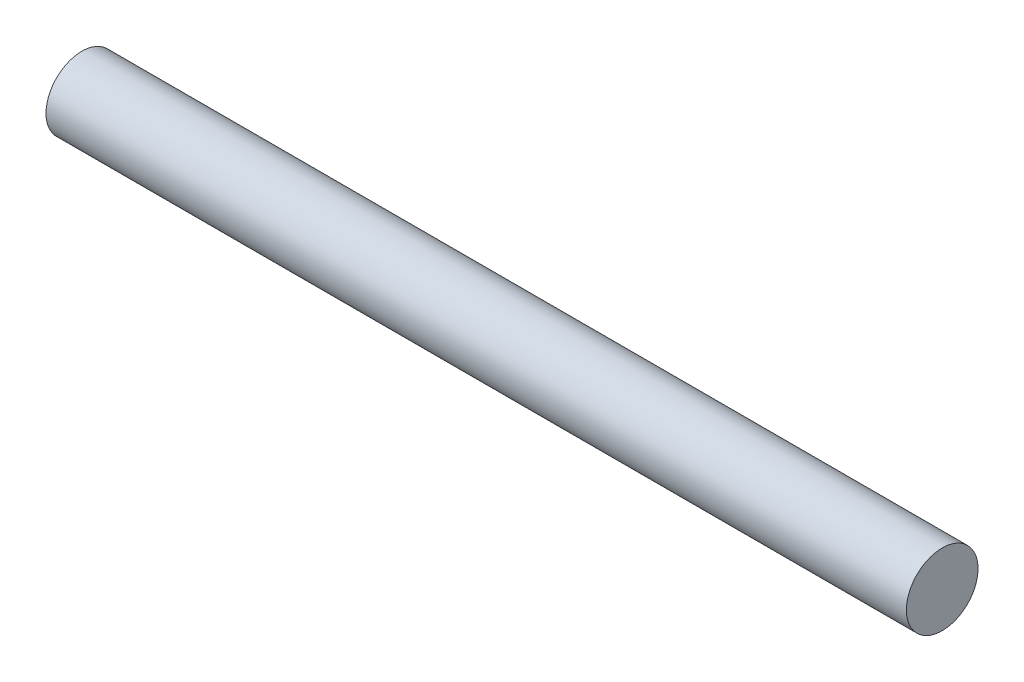
from build123d import *

# Parameters (mm, degrees)
SKIZZE1_R                       = 3.75
AUFSATZ_LINEAR_AUSTRAGEN1_DEPTH = 90


with BuildPart() as part:
    # Skizze1 → Aufsatz-Linear austragen1 (new body)
    with BuildSketch(Plane.YZ):
        Circle(SKIZZE1_R)
    extrude(amount=AUFSATZ_LINEAR_AUSTRAGEN1_DEPTH)


solid = part.part
